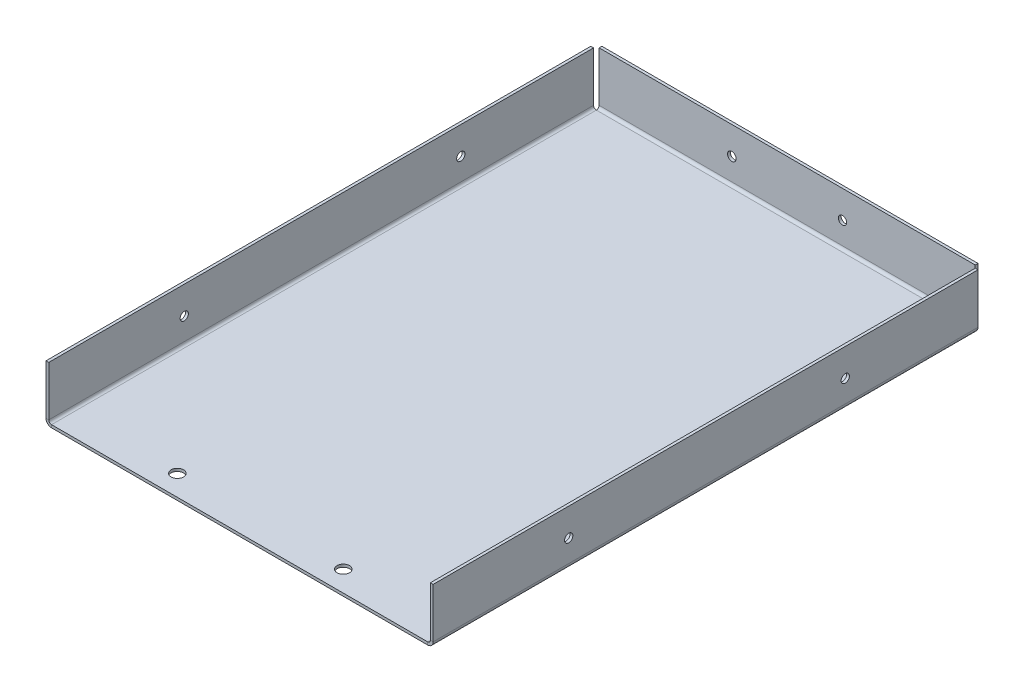
from build123d import *

# Parameters (mm, degrees)
SKETCH1_W                    = 136
SKETCH1_H                    = 198
BASE_FLANGE1_DEPTH           = 1
EDGE_FLANGE1_STRIP_W         = 6
EDGE_FLANGE1_STRIP_H         = 1
EDGE_FLANGE1_STRIP_CUT_DEPTH = 136
EDGE_FLANGE1_DEPTH           = 136
EDGE_FLANGE2_DEPTH           = 197
EDGE_FLANGE3_DEPTH           = 197
CUT_EXTRUDE1_DEPTH           = 515.988593157
CUT_EXTRUDE1_DEPTH_BACK      = 159
SKETCH18_R                   = 1.5
SKETCH21_R                   = 2.25
CUT_EXTRUDE2_DEPTH           = 278
SKETCH26_R                   = 1.5
CUT_EXTRUDE7_DEPTH           = 10
SKETCH33_R                   = 1.55
CUT_EXTRUDE14_DEPTH          = 10


# Sheet-metal steps are written as plain solids
with BuildPart() as part:
    # Sketch1 → Base-Flange1 (new body)
    with BuildSketch(Plane(origin=(0, 0, 0), x_dir=(1, 0, 0), z_dir=(0, 1, 0))):
        with Locations((68, 99)):
            Rectangle(SKETCH1_W, SKETCH1_H)
    extrude(amount=-BASE_FLANGE1_DEPTH)

    # Edge-Flange1 strip (across the edge) → Edge-Flange1 strip cut (cut)
    with BuildSketch(Plane(origin=(136, 0, -198), x_dir=(0, 0, 1), z_dir=(-1, 0, 0))):
        with Locations((-2, -0.5)):
            Rectangle(EDGE_FLANGE1_STRIP_W, EDGE_FLANGE1_STRIP_H)
    extrude(amount=EDGE_FLANGE1_STRIP_CUT_DEPTH, mode=Mode.SUBTRACT)

    # Edge-Flange1 section (across the edge) → Edge-Flange1 (add)
    with BuildSketch(Plane(origin=(136, 0, -198), x_dir=(0, 0, 1), z_dir=(-1, 0, 0))):
        with BuildLine():
            Line((-1, 1), (-1, 19))
            Line((-1, 19), (0, 19))
            Line((0, 19), (0, 1))
            ThreePointArc((0, 1), (0.292893219, 0.292893219), (1, 0))
            Line((1, 0), (1, -1))
            ThreePointArc((1, -1), (-0.414213562, -0.414213562), (-1, 1))
        make_face()
    extrude(amount=EDGE_FLANGE1_DEPTH)

    # Edge-Flange2 section (across the edge) → Edge-Flange2 (add)
    with BuildSketch(Plane(origin=(137, 0, 0), x_dir=(-1, 0, 0), z_dir=(0, 0, -1))):
        with BuildLine():
            Line((-1, 1), (-1, 19))
            Line((-1, 19), (0, 19))
            Line((0, 19), (0, 1))
            ThreePointArc((0, 1), (0.292893219, 0.292893219), (1, 0))
            Line((1, 0), (1, -1))
            ThreePointArc((1, -1), (-0.414213562, -0.414213562), (-1, 1))
        make_face()
    extrude(amount=EDGE_FLANGE2_DEPTH)

    # Edge-Flange3 section (across the edge) → Edge-Flange3 (add)
    with BuildSketch(Plane(origin=(-1, 0, -197), x_dir=(1, 0, 0), z_dir=(0, 0, 1))):
        with BuildLine():
            Line((-1, 1), (-1, 19))
            Line((-1, 19), (0, 19))
            Line((0, 19), (0, 1))
            ThreePointArc((0, 1), (0.292893219, 0.292893219), (1, 0))
            Line((1, 0), (1, -1))
            ThreePointArc((1, -1), (-0.414213562, -0.414213562), (-1, 1))
        make_face()
    extrude(amount=EDGE_FLANGE3_DEPTH)

    # Sketch18 → Cut-Extrude1 (cut, two sides: drawn at the far end of the back side and taken through both)
    with BuildSketch(Plane(origin=(-3, 352.051657269, -347.400026456), x_dir=(0, 0, -1), z_dir=(-1, 0, 0)).offset(-CUT_EXTRUDE1_DEPTH_BACK)):
        with Locations(Location((-298.400026456, 343.051657269, 0), (0, 0, 270))):
            Circle(SKETCH18_R)
        with Locations(Location((-198.400026456, 343.051657269, 0), (0, 0, 270))):
            Circle(SKETCH18_R)
    extrude(amount=CUT_EXTRUDE1_DEPTH + CUT_EXTRUDE1_DEPTH_BACK, mode=Mode.SUBTRACT)

    # Sketch21 → Cut-Extrude2 (cut)
    with BuildSketch(Plane(origin=(-57.062536038, -1, -347.400026456), x_dir=(0, 0, 1), z_dir=(0, -1, 0))):
        with Locations(Location((339.900026456, -95.062536038, 0), (0, 0, 180))):
            Circle(SKETCH21_R)
        with Locations(Location((339.900026456, -155.062536038, 0), (0, 0, 180))):
            Circle(SKETCH21_R)
    extrude(amount=-CUT_EXTRUDE2_DEPTH, mode=Mode.SUBTRACT)

    # Sketch26 → Cut-Extrude7 (cut)
    with BuildSketch(Plane(origin=(-57.062536038, 352.051657269, -200), x_dir=(1, 0, 0), z_dir=(0, 0, -1))):
        with Locations(Location((105.062536038, 343.051657269, 0), (0, 0, 90))):
            Circle(SKETCH26_R)
        with Locations(Location((145.062536038, 343.051657269, 0), (0, 0, 90))):
            Circle(SKETCH26_R)
    extrude(amount=-CUT_EXTRUDE7_DEPTH, mode=Mode.SUBTRACT)

    # Sketch33 → Cut-Extrude14 (cut)
    with BuildSketch(Plane(origin=(193.062536038, -94.051657269, -200), x_dir=(-1, 0, 0), z_dir=(0, 0, -1))):
        with Locations(Location((145.062536038, 103.051657269, 0), (0, 0, 270))):
            Circle(SKETCH33_R)
    extrude(amount=-CUT_EXTRUDE14_DEPTH, mode=Mode.SUBTRACT)


solid = part.part
